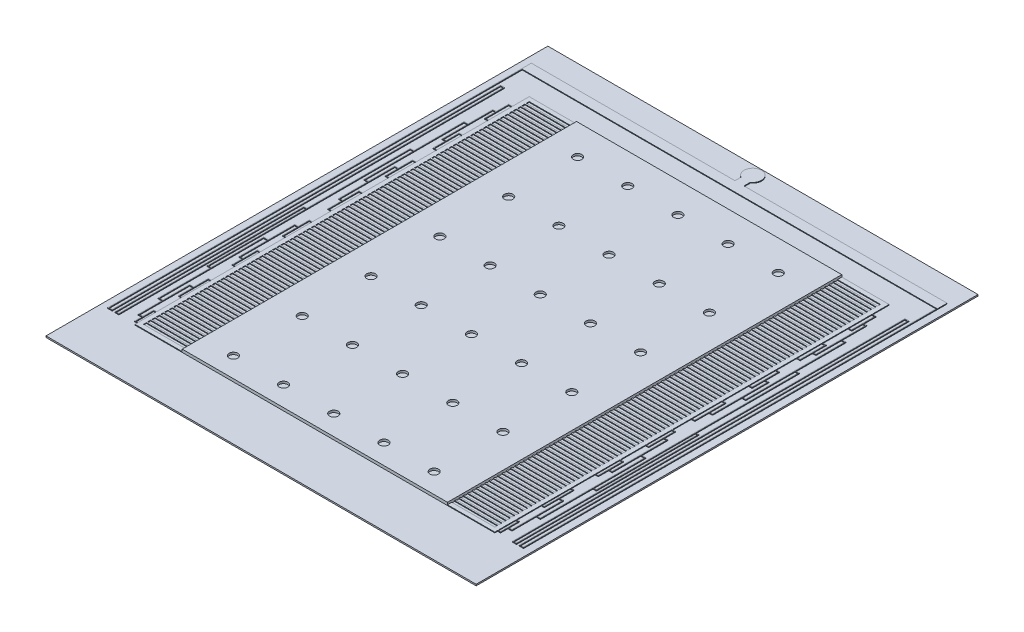
from build123d import *

# Parameters (mm, degrees)
SKETCH3_W            = 30
SKETCH3_H            = 35
BOSS_EXTRUDE2_DEPTH  = 0.1
SKETCH4_W            = 18.5
SKETCH4_H            = 27.5
BOSS_EXTRUDE5_DEPTH  = 0.2
SKETCH6_W            = 0.211382016
SKETCH6_H            = 1.603769596
SKETCH6_W_2          = 0.205195515
SKETCH6_H_2          = 1.721308545
SKETCH6_W_3          = 0.197922695
SKETCH6_H_3          = 1.817675336
SKETCH6_W_4          = 0.201706459
SKETCH6_H_4          = 2.081358624
SKETCH6_W_5          = 0.1704568
SKETCH6_H_5          = 1.774483983
SKETCH6_H_6          = 1.660070327
SKETCH6_W_6          = 0.157207296
SKETCH6_H_7          = 1.980065268
SKETCH6_H_8          = 1.224341961
BOSS_EXTRUDE10_DEPTH = 0.05
SKETCH7_W            = 3
SKETCH7_H            = 0.2
CUT_EXTRUDE2_DEPTH   = 0.1
SKETCH8_R            = 0.3
CUT_EXTRUDE3_DEPTH   = 0.15


with BuildPart() as part:
    # Sketch3 → Boss-Extrude2 (new body)
    with BuildSketch(Plane(origin=(0, 0, 0), x_dir=(1, 0, 0), z_dir=(0, 1, 0))):
        Rectangle(SKETCH3_W, SKETCH3_H)
    extrude(amount=BOSS_EXTRUDE2_DEPTH)



with BuildPart() as body_2:
    # Sketch4 → Boss-Extrude5 (new body)
    with BuildSketch(Plane(origin=(0, 0.1, 0), x_dir=(1, 0, 0), z_dir=(0, 1, 0))):
        Rectangle(SKETCH4_W, SKETCH4_H)
    extrude(amount=BOSS_EXTRUDE5_DEPTH)


with BuildPart() as part_1:
    add(part.part)

    add(body_2.part)  # Boss-Extrude10 merges body 2
    # Sketch6 → Boss-Extrude10 (add)
    with BuildSketch(Plane(origin=(0, 0.1, 0), x_dir=(1, 0, 0), z_dir=(0, 1, 0))):
        with BuildLine():
            Line((-0.296809866, 15.847390228), (-14.5, 15.847390228))
            Line((-14.5, 15.847390228), (-14.5, -13.694209009))
            Line((-14.5, -13.694209009), (-14.189003398, -13.694209009))
            Line((-14.189003398, -13.694209009), (-14.189003398, 13.393625624))
            Line((-14.189003398, 13.393625624), (-14.007853659, 13.393625624))
            Line((-14.007853659, 13.393625624), (-14.007853659, -13.695971627))
            Line((-14.007853659, -13.695971627), (-13.724275414, -13.695971627))
            Line((-13.724275414, -13.695971627), (-13.724275414, -0.799347863))
            Line((-13.724275414, -0.799347863), (-13.56977005, -0.799347863))
            Line((-13.56977005, -0.799347863), (-13.56977005, -7.686248839))
            Line((-13.56977005, -7.686248839), (-13.33084503, -7.686248839))
            Line((-13.33084503, -7.686248839), (-13.33084503, -11.352681055))
            Line((-13.33084503, -11.352681055), (-13.039851306, -11.352681055))
            Line((-13.039851306, -11.352681055), (-13.039851306, -13.03981721))
            Line((-13.039851306, -13.03981721), (-12.757207296, -13.03981721))
            Line((-12.757207296, -13.03981721), (-12.757207296, -13.557084166))
            Line((-12.757207296, -13.557084166), (-12.55, -13.557084166))
            Line((-12.55, -13.557084166), (-12.55, -13.75))
            Line((-12.55, -13.75), (-9.25, -13.75))
            Line((-9.25, -13.75), (-9.25, 13.75))
            Line((-9.25, 13.75), (-12.55, 13.75))
            Line((-12.55, 13.75), (-12.55, 12.581818208))
            Line((-12.55, 12.581818208), (-12.811382016, 12.581818208))
            Line((-12.811382016, 12.581818208), (-12.811382016, 11.702139278))
            Line((-12.811382016, 11.702139278), (-13.039543899, 11.702139278))
            Line((-13.039543899, 11.702139278), (-13.039543899, 9.973586997))
            Line((-13.039543899, 9.973586997), (-13.316086526, 9.973586997))
            Line((-13.316086526, 9.973586997), (-13.316086526, 6.471730618))
            Line((-13.316086526, 6.471730618), (-13.56977005, 6.471730618))
            Line((-13.56977005, 6.471730618), (-13.56977005, -0.749347863))
            Line((-13.56977005, -0.749347863), (-13.774275414, -0.749347863))
            Line((-13.774275414, -0.749347863), (-13.774275414, -13.645971627))
            Line((-13.774275414, -13.645971627), (-13.957853659, -13.645971627))
            Line((-13.957853659, -13.645971627), (-13.957853659, 13.443625624))
            Line((-13.957853659, 13.443625624), (-14.239003398, 13.443625624))
            Line((-14.239003398, 13.443625624), (-14.239003398, -13.644209009))
            Line((-14.239003398, -13.644209009), (-14.45, -13.644209009))
            Line((-14.45, -13.644209009), (-14.45, 15.162745559))
            Line((-14.45, 15.162745559), (14.45, 15.162745559))
            Line((14.45, 15.162745559), (14.45, -13.644209009))
            Line((14.45, -13.644209009), (14.239003398, -13.644209009))
            Line((14.239003398, -13.644209009), (14.239003398, 13.443625624))
            Line((14.239003398, 13.443625624), (13.957853659, 13.443625624))
            Line((13.957853659, 13.443625624), (13.957853659, -13.645971627))
            Line((13.957853659, -13.645971627), (13.774275414, -13.645971627))
            Line((13.774275414, -13.645971627), (13.774275414, -0.749347863))
            Line((13.774275414, -0.749347863), (13.56977005, -0.749347863))
            Line((13.56977005, -0.749347863), (13.56977005, 6.471730618))
            Line((13.56977005, 6.471730618), (13.316086526, 6.471730618))
            Line((13.316086526, 6.471730618), (13.316086526, 9.973586997))
            Line((13.316086526, 9.973586997), (13.039543899, 9.973586997))
            Line((13.039543899, 9.973586997), (13.039543899, 11.702139278))
            Line((13.039543899, 11.702139278), (12.811382016, 11.702139278))
            Line((12.811382016, 11.702139278), (12.811382016, 12.581818208))
            Line((12.811382016, 12.581818208), (12.55, 12.581818208))
            Line((12.55, 12.581818208), (12.55, 13.75))
            Line((12.55, 13.75), (9.25, 13.75))
            Line((9.25, 13.75), (9.25, -13.75))
            Line((9.25, -13.75), (12.55, -13.75))
            Line((12.55, -13.75), (12.55, -13.557084166))
            Line((12.55, -13.557084166), (12.757207296, -13.557084166))
            Line((12.757207296, -13.557084166), (12.757207296, -13.03981721))
            Line((12.757207296, -13.03981721), (13.039851306, -13.03981721))
            Line((13.039851306, -13.03981721), (13.039851306, -11.352681055))
            Line((13.039851306, -11.352681055), (13.33084503, -11.352681055))
            Line((13.33084503, -11.352681055), (13.33084503, -7.686248839))
            Line((13.33084503, -7.686248839), (13.56977005, -7.686248839))
            Line((13.56977005, -7.686248839), (13.56977005, -0.799347863))
            Line((13.56977005, -0.799347863), (13.724275414, -0.799347863))
            Line((13.724275414, -0.799347863), (13.724275414, -13.695971627))
            Line((13.724275414, -13.695971627), (14.007853659, -13.695971627))
            Line((14.007853659, -13.695971627), (14.007853659, 13.393625624))
            Line((14.007853659, 13.393625624), (14.189003398, 13.393625624))
            Line((14.189003398, 13.393625624), (14.189003398, -13.694209009))
            Line((14.189003398, -13.694209009), (14.5, -13.694209009))
            Line((14.5, -13.694209009), (14.5, 15.847390228))
            Line((14.5, 15.847390228), (0.33596793, 15.847390228))
            Line((0.33596793, 15.847390228), (0.33596793, 16.289908331))
            ThreePointArc((0.33596793, 16.289908331), (-0.022955128, 17.400932864), (-0.296809866, 16.265941738))
            Line((-0.296809866, 16.265941738), (-0.296809866, 15.847390228))
        make_face()
        with Locations((-12.655691008, 11.72993341)):
            Rectangle(SKETCH6_W, SKETCH6_H, mode=Mode.SUBTRACT)
        Polygon((-12.811382016, 10.878048612), (-12.55, 10.878048612), (-12.55, 9.112513729), (-12.805195515, 9.112513729), (-12.805195515, 8.207460352), (-12.989543899, 8.207460352), (-12.989543899, 11.652139278), (-12.811382016, 11.652139278), align=None, mode=Mode.SUBTRACT)
        with Locations((-12.652597758, 8.201859457)):
            Rectangle(SKETCH6_W_2, SKETCH6_H_2, mode=Mode.SUBTRACT)
        Polygon((-12.805195515, 7.291205184), (-12.55, 7.291205184), (-12.55, 5.863231856), (-12.797922695, 5.863231856), (-12.797922695, 4.872175714), (-13.044120695, 4.872175714), (-13.044120695, 3.034439681), (-13.266086526, 3.034439681), (-13.266086526, 9.923586997), (-13.039543899, 9.923586997), (-13.039543899, 8.157460352), (-12.805195515, 8.157460352), align=None, mode=Mode.SUBTRACT)
        with Locations((-12.648961348, 4.904394188)):
            Rectangle(SKETCH6_W_3, SKETCH6_H_3, mode=Mode.SUBTRACT)
        Polygon((-12.797922695, 3.94555652), (-12.55, 3.94555652), (-12.55, 2.131358624), (-12.801706459, 2.131358624), (-12.801706459, 0.989514943), (-12.994120695, 0.989514943), (-12.994120695, 4.822175714), (-12.797922695, 4.822175714), align=None, mode=Mode.SUBTRACT)
        with Locations((-12.65085323, 1.040679312)):
            Rectangle(SKETCH6_W_4, SKETCH6_H_4, mode=Mode.SUBTRACT)
        Polygon((-12.801706459, -0.05), (-12.55, -0.05), (-12.55, -1.362951225), (-12.7704568, -1.362951225), (-12.7704568, -2.137736179), (-13.014658955, -2.137736179), (-13.014658955, -3.988239391), (-13.33084503, -3.988239391), (-13.33084503, -7.636248839), (-13.51977005, -7.636248839), (-13.51977005, 6.421730618), (-13.316086526, 6.421730618), (-13.316086526, 2.984439681), (-13.044120695, 2.984439681), (-13.044120695, 0.939514943), (-12.801706459, 0.939514943), align=None, mode=Mode.SUBTRACT)
        with Locations((-12.6352284, -2.300193217)):
            Rectangle(SKETCH6_W_5, SKETCH6_H_5, mode=Mode.SUBTRACT)
        Polygon((-12.7704568, -3.237435208), (-12.55, -3.237435208), (-12.55, -4.988354149), (-12.7704568, -4.988354149), (-12.7704568, -5.98071835), (-12.964658955, -5.98071835), (-12.964658955, -2.187736179), (-12.7704568, -2.187736179), align=None, mode=Mode.SUBTRACT)
        with Locations((-12.6352284, -5.868389312)):
            Rectangle(SKETCH6_W_5, SKETCH6_H_6, mode=Mode.SUBTRACT)
        Polygon((-12.7704568, -6.748424476), (-12.55, -6.748424476), (-12.55, -8.421954299), (-12.757207296, -8.421954299), (-12.757207296, -9.437671871), (-13.039851306, -9.437671871), (-13.039851306, -11.302681055), (-13.28084503, -11.302681055), (-13.28084503, -4.038239391), (-13.014658955, -4.038239391), (-13.014658955, -6.03071835), (-12.7704568, -6.03071835), align=None, mode=Mode.SUBTRACT)
        with Locations((-12.628603648, -9.461986933)):
            Rectangle(SKETCH6_W_6, SKETCH6_H_7, mode=Mode.SUBTRACT)
        Polygon((-12.757207296, -10.502019567), (-12.55, -10.502019567), (-12.55, -12.232742205), (-12.757207296, -12.232742205), (-12.757207296, -12.98981721), (-12.989851306, -12.98981721), (-12.989851306, -9.487671871), (-12.757207296, -9.487671871), align=None, mode=Mode.SUBTRACT)
        with Locations((-12.628603648, -12.894913186)):
            Rectangle(SKETCH6_W_6, SKETCH6_H_8, mode=Mode.SUBTRACT)
        with Locations((12.628603648, -12.894913186)):
            Rectangle(SKETCH6_W_6, SKETCH6_H_8, mode=Mode.SUBTRACT)
        Polygon((12.757207296, -12.232742205), (12.55, -12.232742205), (12.55, -10.502019567), (12.757207296, -10.502019567), (12.757207296, -9.487671871), (12.989851306, -9.487671871), (12.989851306, -12.98981721), (12.757207296, -12.98981721), align=None, mode=Mode.SUBTRACT)
        with Locations((12.628603648, -9.461986933)):
            Rectangle(SKETCH6_W_6, SKETCH6_H_7, mode=Mode.SUBTRACT)
        Polygon((12.757207296, -8.421954299), (12.55, -8.421954299), (12.55, -6.748424476), (12.7704568, -6.748424476), (12.7704568, -6.03071835), (13.014658955, -6.03071835), (13.014658955, -4.038239391), (13.28084503, -4.038239391), (13.28084503, -11.302681055), (13.039851306, -11.302681055), (13.039851306, -9.437671871), (12.757207296, -9.437671871), align=None, mode=Mode.SUBTRACT)
        with Locations((12.6352284, -5.868389312)):
            Rectangle(SKETCH6_W_5, SKETCH6_H_6, mode=Mode.SUBTRACT)
        Polygon((12.7704568, -4.988354149), (12.55, -4.988354149), (12.55, -3.237435208), (12.7704568, -3.237435208), (12.7704568, -2.187736179), (12.964658955, -2.187736179), (12.964658955, -5.98071835), (12.7704568, -5.98071835), align=None, mode=Mode.SUBTRACT)
        with Locations((12.6352284, -2.300193217)):
            Rectangle(SKETCH6_W_5, SKETCH6_H_5, mode=Mode.SUBTRACT)
        Polygon((12.7704568, -1.362951225), (12.55, -1.362951225), (12.55, -0.05), (12.801706459, -0.05), (12.801706459, 0.939514943), (13.044120695, 0.939514943), (13.044120695, 2.984439681), (13.316086526, 2.984439681), (13.316086526, 6.421730618), (13.51977005, 6.421730618), (13.51977005, -7.636248839), (13.33084503, -7.636248839), (13.33084503, -3.988239391), (13.014658955, -3.988239391), (13.014658955, -2.137736179), (12.7704568, -2.137736179), align=None, mode=Mode.SUBTRACT)
        with Locations((12.65085323, 1.040679312)):
            Rectangle(SKETCH6_W_4, SKETCH6_H_4, mode=Mode.SUBTRACT)
        Polygon((12.801706459, 2.131358624), (12.55, 2.131358624), (12.55, 3.94555652), (12.797922695, 3.94555652), (12.797922695, 4.822175714), (12.994120695, 4.822175714), (12.994120695, 0.989514943), (12.801706459, 0.989514943), align=None, mode=Mode.SUBTRACT)
        with Locations((12.648961348, 4.904394188)):
            Rectangle(SKETCH6_W_3, SKETCH6_H_3, mode=Mode.SUBTRACT)
        Polygon((12.797922695, 5.863231856), (12.55, 5.863231856), (12.55, 7.291205184), (12.805195515, 7.291205184), (12.805195515, 8.157460352), (13.039543899, 8.157460352), (13.039543899, 9.923586997), (13.266086526, 9.923586997), (13.266086526, 3.034439681), (13.044120695, 3.034439681), (13.044120695, 4.872175714), (12.797922695, 4.872175714), align=None, mode=Mode.SUBTRACT)
        with Locations((12.652597758, 8.201859457)):
            Rectangle(SKETCH6_W_2, SKETCH6_H_2, mode=Mode.SUBTRACT)
        Polygon((12.805195515, 9.112513729), (12.55, 9.112513729), (12.55, 10.878048612), (12.811382016, 10.878048612), (12.811382016, 11.652139278), (12.989543899, 11.652139278), (12.989543899, 8.207460352), (12.805195515, 8.207460352), align=None, mode=Mode.SUBTRACT)
        with Locations((12.655691008, 11.72993341)):
            Rectangle(SKETCH6_W, SKETCH6_H, mode=Mode.SUBTRACT)
    extrude(amount=BOSS_EXTRUDE10_DEPTH)

    # Sketch7 → Cut-Extrude2 (cut)
    with BuildSketch(Plane(origin=(0, 0.1, 0), x_dir=(1, 0, 0), z_dir=(0, 1, 0))):
        with Locations((10.75, 13.35)):
            Rectangle(SKETCH7_W, SKETCH7_H)
        with Locations((10.75, 13.05)):
            Rectangle(SKETCH7_W, SKETCH7_H)
        with Locations((10.75, 12.75)):
            Rectangle(SKETCH7_W, SKETCH7_H)
        with Locations((10.75, 12.45)):
            Rectangle(SKETCH7_W, SKETCH7_H)
        with Locations((10.75, 12.15)):
            Rectangle(SKETCH7_W, SKETCH7_H)
        with Locations((10.75, 11.85)):
            Rectangle(SKETCH7_W, SKETCH7_H)
        with Locations((10.75, 11.55)):
            Rectangle(SKETCH7_W, SKETCH7_H)
        with Locations((10.75, 11.25)):
            Rectangle(SKETCH7_W, SKETCH7_H)
        with Locations((10.75, 10.95)):
            Rectangle(SKETCH7_W, SKETCH7_H)
        with Locations((10.75, 10.65)):
            Rectangle(SKETCH7_W, SKETCH7_H)
        with Locations((10.75, 10.35)):
            Rectangle(SKETCH7_W, SKETCH7_H)
        with Locations((10.75, 10.05)):
            Rectangle(SKETCH7_W, SKETCH7_H)
        with Locations((10.75, 9.75)):
            Rectangle(SKETCH7_W, SKETCH7_H)
        with Locations((10.75, 9.45)):
            Rectangle(SKETCH7_W, SKETCH7_H)
        with Locations((10.75, 9.15)):
            Rectangle(SKETCH7_W, SKETCH7_H)
        with Locations((10.75, 8.85)):
            Rectangle(SKETCH7_W, SKETCH7_H)
        with Locations((10.75, 8.55)):
            Rectangle(SKETCH7_W, SKETCH7_H)
        with Locations((10.75, 8.25)):
            Rectangle(SKETCH7_W, SKETCH7_H)
        with Locations((10.75, 7.95)):
            Rectangle(SKETCH7_W, SKETCH7_H)
        with Locations((10.75, 7.65)):
            Rectangle(SKETCH7_W, SKETCH7_H)
        with Locations((10.75, 7.35)):
            Rectangle(SKETCH7_W, SKETCH7_H)
        with Locations((10.75, 7.05)):
            Rectangle(SKETCH7_W, SKETCH7_H)
        with Locations((10.75, 6.75)):
            Rectangle(SKETCH7_W, SKETCH7_H)
        with Locations((10.75, 6.45)):
            Rectangle(SKETCH7_W, SKETCH7_H)
        with Locations((10.75, 6.15)):
            Rectangle(SKETCH7_W, SKETCH7_H)
        with Locations((10.75, 5.85)):
            Rectangle(SKETCH7_W, SKETCH7_H)
        with Locations((10.75, 5.55)):
            Rectangle(SKETCH7_W, SKETCH7_H)
        with Locations((10.75, 5.25)):
            Rectangle(SKETCH7_W, SKETCH7_H)
        with Locations((10.75, 4.95)):
            Rectangle(SKETCH7_W, SKETCH7_H)
        with Locations((10.75, 4.65)):
            Rectangle(SKETCH7_W, SKETCH7_H)
        with Locations((10.75, 4.35)):
            Rectangle(SKETCH7_W, SKETCH7_H)
        with Locations((10.75, 4.05)):
            Rectangle(SKETCH7_W, SKETCH7_H)
        with Locations((10.75, 3.75)):
            Rectangle(SKETCH7_W, SKETCH7_H)
        with Locations((10.75, 3.45)):
            Rectangle(SKETCH7_W, SKETCH7_H)
        with Locations((10.75, 3.15)):
            Rectangle(SKETCH7_W, SKETCH7_H)
        with Locations((10.75, 2.85)):
            Rectangle(SKETCH7_W, SKETCH7_H)
        with Locations((10.75, 2.55)):
            Rectangle(SKETCH7_W, SKETCH7_H)
        with Locations((10.75, 2.25)):
            Rectangle(SKETCH7_W, SKETCH7_H)
        with Locations((10.75, 1.95)):
            Rectangle(SKETCH7_W, SKETCH7_H)
        with Locations((10.75, 1.65)):
            Rectangle(SKETCH7_W, SKETCH7_H)
        with Locations((10.75, 1.35)):
            Rectangle(SKETCH7_W, SKETCH7_H)
        with Locations((10.75, 1.05)):
            Rectangle(SKETCH7_W, SKETCH7_H)
        with Locations((10.75, 0.75)):
            Rectangle(SKETCH7_W, SKETCH7_H)
        with Locations((10.75, 0.45)):
            Rectangle(SKETCH7_W, SKETCH7_H)
        with Locations((10.75, 0.15)):
            Rectangle(SKETCH7_W, SKETCH7_H)
        with Locations((10.75, -0.15)):
            Rectangle(SKETCH7_W, SKETCH7_H)
        with Locations((10.75, -0.45)):
            Rectangle(SKETCH7_W, SKETCH7_H)
        with Locations((10.75, -0.75)):
            Rectangle(SKETCH7_W, SKETCH7_H)
        with Locations((10.75, -1.05)):
            Rectangle(SKETCH7_W, SKETCH7_H)
        with Locations((10.75, -1.35)):
            Rectangle(SKETCH7_W, SKETCH7_H)
        with Locations((10.75, -1.65)):
            Rectangle(SKETCH7_W, SKETCH7_H)
        with Locations((10.75, -1.95)):
            Rectangle(SKETCH7_W, SKETCH7_H)
        with Locations((10.75, -2.25)):
            Rectangle(SKETCH7_W, SKETCH7_H)
        with Locations((10.75, -2.55)):
            Rectangle(SKETCH7_W, SKETCH7_H)
        with Locations((10.75, -2.85)):
            Rectangle(SKETCH7_W, SKETCH7_H)
        with Locations((10.75, -3.15)):
            Rectangle(SKETCH7_W, SKETCH7_H)
        with Locations((10.75, -3.45)):
            Rectangle(SKETCH7_W, SKETCH7_H)
        with Locations((10.75, -3.75)):
            Rectangle(SKETCH7_W, SKETCH7_H)
        with Locations((10.75, -4.05)):
            Rectangle(SKETCH7_W, SKETCH7_H)
        with Locations((10.75, -4.35)):
            Rectangle(SKETCH7_W, SKETCH7_H)
        with Locations((10.75, -4.65)):
            Rectangle(SKETCH7_W, SKETCH7_H)
        with Locations((10.75, -4.95)):
            Rectangle(SKETCH7_W, SKETCH7_H)
        with Locations((10.75, -5.25)):
            Rectangle(SKETCH7_W, SKETCH7_H)
        with Locations((10.75, -5.55)):
            Rectangle(SKETCH7_W, SKETCH7_H)
        with Locations((10.75, -5.85)):
            Rectangle(SKETCH7_W, SKETCH7_H)
        with Locations((10.75, -6.15)):
            Rectangle(SKETCH7_W, SKETCH7_H)
        with Locations((10.75, -6.45)):
            Rectangle(SKETCH7_W, SKETCH7_H)
        with Locations((10.75, -6.75)):
            Rectangle(SKETCH7_W, SKETCH7_H)
        with Locations((10.75, -7.05)):
            Rectangle(SKETCH7_W, SKETCH7_H)
        with Locations((10.75, -7.35)):
            Rectangle(SKETCH7_W, SKETCH7_H)
        with Locations((10.75, -7.65)):
            Rectangle(SKETCH7_W, SKETCH7_H)
        with Locations((10.75, -7.95)):
            Rectangle(SKETCH7_W, SKETCH7_H)
        with Locations((10.75, -8.25)):
            Rectangle(SKETCH7_W, SKETCH7_H)
        with Locations((10.75, -8.55)):
            Rectangle(SKETCH7_W, SKETCH7_H)
        with Locations((10.75, -8.85)):
            Rectangle(SKETCH7_W, SKETCH7_H)
        with Locations((10.75, -9.15)):
            Rectangle(SKETCH7_W, SKETCH7_H)
        with Locations((10.75, -9.45)):
            Rectangle(SKETCH7_W, SKETCH7_H)
        with Locations((10.75, -9.75)):
            Rectangle(SKETCH7_W, SKETCH7_H)
        with Locations((10.75, -10.05)):
            Rectangle(SKETCH7_W, SKETCH7_H)
        with Locations((10.75, -10.35)):
            Rectangle(SKETCH7_W, SKETCH7_H)
        with Locations((10.75, -10.65)):
            Rectangle(SKETCH7_W, SKETCH7_H)
        with Locations((10.75, -10.95)):
            Rectangle(SKETCH7_W, SKETCH7_H)
        with Locations((10.75, -11.25)):
            Rectangle(SKETCH7_W, SKETCH7_H)
        with Locations((10.75, -11.55)):
            Rectangle(SKETCH7_W, SKETCH7_H)
        with Locations((10.75, -11.85)):
            Rectangle(SKETCH7_W, SKETCH7_H)
        with Locations((10.75, -12.15)):
            Rectangle(SKETCH7_W, SKETCH7_H)
        with Locations((10.75, -12.45)):
            Rectangle(SKETCH7_W, SKETCH7_H)
        with Locations((10.75, -12.75)):
            Rectangle(SKETCH7_W, SKETCH7_H)
        with Locations((10.75, -13.05)):
            Rectangle(SKETCH7_W, SKETCH7_H)
        with Locations((10.75, -13.35)):
            Rectangle(SKETCH7_W, SKETCH7_H)
        with Locations((-10.75, 13.35)):
            Rectangle(SKETCH7_W, SKETCH7_H)
        with Locations((-10.75, 13.05)):
            Rectangle(SKETCH7_W, SKETCH7_H)
        with Locations((-10.75, 12.75)):
            Rectangle(SKETCH7_W, SKETCH7_H)
        with Locations((-10.75, 12.45)):
            Rectangle(SKETCH7_W, SKETCH7_H)
        with Locations((-10.75, 12.15)):
            Rectangle(SKETCH7_W, SKETCH7_H)
        with Locations((-10.75, 11.85)):
            Rectangle(SKETCH7_W, SKETCH7_H)
        with Locations((-10.75, 11.55)):
            Rectangle(SKETCH7_W, SKETCH7_H)
        with Locations((-10.75, 11.25)):
            Rectangle(SKETCH7_W, SKETCH7_H)
        with Locations((-10.75, 10.95)):
            Rectangle(SKETCH7_W, SKETCH7_H)
        with Locations((-10.75, 10.65)):
            Rectangle(SKETCH7_W, SKETCH7_H)
        with Locations((-10.75, 10.35)):
            Rectangle(SKETCH7_W, SKETCH7_H)
        with Locations((-10.75, 10.05)):
            Rectangle(SKETCH7_W, SKETCH7_H)
        with Locations((-10.75, 9.75)):
            Rectangle(SKETCH7_W, SKETCH7_H)
        with Locations((-10.75, 9.45)):
            Rectangle(SKETCH7_W, SKETCH7_H)
        with Locations((-10.75, 9.15)):
            Rectangle(SKETCH7_W, SKETCH7_H)
        with Locations((-10.75, 8.85)):
            Rectangle(SKETCH7_W, SKETCH7_H)
        with Locations((-10.75, 8.55)):
            Rectangle(SKETCH7_W, SKETCH7_H)
        with Locations((-10.75, 8.25)):
            Rectangle(SKETCH7_W, SKETCH7_H)
        with Locations((-10.75, 7.95)):
            Rectangle(SKETCH7_W, SKETCH7_H)
        with Locations((-10.75, 7.65)):
            Rectangle(SKETCH7_W, SKETCH7_H)
        with Locations((-10.75, 7.35)):
            Rectangle(SKETCH7_W, SKETCH7_H)
        with Locations((-10.75, 7.05)):
            Rectangle(SKETCH7_W, SKETCH7_H)
        with Locations((-10.75, 6.75)):
            Rectangle(SKETCH7_W, SKETCH7_H)
        with Locations((-10.75, 6.45)):
            Rectangle(SKETCH7_W, SKETCH7_H)
        with Locations((-10.75, 6.15)):
            Rectangle(SKETCH7_W, SKETCH7_H)
        with Locations((-10.75, 5.85)):
            Rectangle(SKETCH7_W, SKETCH7_H)
        with Locations((-10.75, 5.55)):
            Rectangle(SKETCH7_W, SKETCH7_H)
        with Locations((-10.75, 5.25)):
            Rectangle(SKETCH7_W, SKETCH7_H)
        with Locations((-10.75, 4.95)):
            Rectangle(SKETCH7_W, SKETCH7_H)
        with Locations((-10.75, 4.65)):
            Rectangle(SKETCH7_W, SKETCH7_H)
        with Locations((-10.75, 4.35)):
            Rectangle(SKETCH7_W, SKETCH7_H)
        with Locations((-10.75, 4.05)):
            Rectangle(SKETCH7_W, SKETCH7_H)
        with Locations((-10.75, 3.75)):
            Rectangle(SKETCH7_W, SKETCH7_H)
        with Locations((-10.75, 3.45)):
            Rectangle(SKETCH7_W, SKETCH7_H)
        with Locations((-10.75, 3.15)):
            Rectangle(SKETCH7_W, SKETCH7_H)
        with Locations((-10.75, 2.85)):
            Rectangle(SKETCH7_W, SKETCH7_H)
        with Locations((-10.75, 2.55)):
            Rectangle(SKETCH7_W, SKETCH7_H)
        with Locations((-10.75, 2.25)):
            Rectangle(SKETCH7_W, SKETCH7_H)
        with Locations((-10.75, 1.95)):
            Rectangle(SKETCH7_W, SKETCH7_H)
        with Locations((-10.75, 1.65)):
            Rectangle(SKETCH7_W, SKETCH7_H)
        with Locations((-10.75, 1.35)):
            Rectangle(SKETCH7_W, SKETCH7_H)
        with Locations((-10.75, 1.05)):
            Rectangle(SKETCH7_W, SKETCH7_H)
        with Locations((-10.75, 0.75)):
            Rectangle(SKETCH7_W, SKETCH7_H)
        with Locations((-10.75, 0.45)):
            Rectangle(SKETCH7_W, SKETCH7_H)
        with Locations((-10.75, 0.15)):
            Rectangle(SKETCH7_W, SKETCH7_H)
        with Locations((-10.75, -0.15)):
            Rectangle(SKETCH7_W, SKETCH7_H)
        with Locations((-10.75, -0.45)):
            Rectangle(SKETCH7_W, SKETCH7_H)
        with Locations((-10.75, -0.75)):
            Rectangle(SKETCH7_W, SKETCH7_H)
        with Locations((-10.75, -1.05)):
            Rectangle(SKETCH7_W, SKETCH7_H)
        with Locations((-10.75, -1.35)):
            Rectangle(SKETCH7_W, SKETCH7_H)
        with Locations((-10.75, -1.65)):
            Rectangle(SKETCH7_W, SKETCH7_H)
        with Locations((-10.75, -1.95)):
            Rectangle(SKETCH7_W, SKETCH7_H)
        with Locations((-10.75, -2.25)):
            Rectangle(SKETCH7_W, SKETCH7_H)
        with Locations((-10.75, -2.55)):
            Rectangle(SKETCH7_W, SKETCH7_H)
        with Locations((-10.75, -2.85)):
            Rectangle(SKETCH7_W, SKETCH7_H)
        with Locations((-10.75, -3.15)):
            Rectangle(SKETCH7_W, SKETCH7_H)
        with Locations((-10.75, -3.45)):
            Rectangle(SKETCH7_W, SKETCH7_H)
        with Locations((-10.75, -3.75)):
            Rectangle(SKETCH7_W, SKETCH7_H)
        with Locations((-10.75, -4.05)):
            Rectangle(SKETCH7_W, SKETCH7_H)
        with Locations((-10.75, -4.35)):
            Rectangle(SKETCH7_W, SKETCH7_H)
        with Locations((-10.75, -4.65)):
            Rectangle(SKETCH7_W, SKETCH7_H)
        with Locations((-10.75, -4.95)):
            Rectangle(SKETCH7_W, SKETCH7_H)
        with Locations((-10.75, -5.25)):
            Rectangle(SKETCH7_W, SKETCH7_H)
        with Locations((-10.75, -5.55)):
            Rectangle(SKETCH7_W, SKETCH7_H)
        with Locations((-10.75, -5.85)):
            Rectangle(SKETCH7_W, SKETCH7_H)
        with Locations((-10.75, -6.15)):
            Rectangle(SKETCH7_W, SKETCH7_H)
        with Locations((-10.75, -6.45)):
            Rectangle(SKETCH7_W, SKETCH7_H)
        with Locations((-10.75, -6.75)):
            Rectangle(SKETCH7_W, SKETCH7_H)
        with Locations((-10.75, -7.05)):
            Rectangle(SKETCH7_W, SKETCH7_H)
        with Locations((-10.75, -7.35)):
            Rectangle(SKETCH7_W, SKETCH7_H)
        with Locations((-10.75, -7.65)):
            Rectangle(SKETCH7_W, SKETCH7_H)
        with Locations((-10.75, -7.95)):
            Rectangle(SKETCH7_W, SKETCH7_H)
        with Locations((-10.75, -8.25)):
            Rectangle(SKETCH7_W, SKETCH7_H)
        with Locations((-10.75, -8.55)):
            Rectangle(SKETCH7_W, SKETCH7_H)
        with Locations((-10.75, -8.85)):
            Rectangle(SKETCH7_W, SKETCH7_H)
        with Locations((-10.75, -9.15)):
            Rectangle(SKETCH7_W, SKETCH7_H)
        with Locations((-10.75, -9.45)):
            Rectangle(SKETCH7_W, SKETCH7_H)
        with Locations((-10.75, -9.75)):
            Rectangle(SKETCH7_W, SKETCH7_H)
        with Locations((-10.75, -10.05)):
            Rectangle(SKETCH7_W, SKETCH7_H)
        with Locations((-10.75, -10.35)):
            Rectangle(SKETCH7_W, SKETCH7_H)
        with Locations((-10.75, -10.65)):
            Rectangle(SKETCH7_W, SKETCH7_H)
        with Locations((-10.75, -10.95)):
            Rectangle(SKETCH7_W, SKETCH7_H)
        with Locations((-10.75, -11.25)):
            Rectangle(SKETCH7_W, SKETCH7_H)
        with Locations((-10.75, -11.55)):
            Rectangle(SKETCH7_W, SKETCH7_H)
        with Locations((-10.75, -11.85)):
            Rectangle(SKETCH7_W, SKETCH7_H)
        with Locations((-10.75, -12.15)):
            Rectangle(SKETCH7_W, SKETCH7_H)
        with Locations((-10.75, -12.45)):
            Rectangle(SKETCH7_W, SKETCH7_H)
        with Locations((-10.75, -12.75)):
            Rectangle(SKETCH7_W, SKETCH7_H)
        with Locations((-10.75, -13.05)):
            Rectangle(SKETCH7_W, SKETCH7_H)
        with Locations((-10.75, -13.35)):
            Rectangle(SKETCH7_W, SKETCH7_H)
    extrude(amount=CUT_EXTRUDE2_DEPTH, mode=Mode.SUBTRACT)

    # Sketch8 → Cut-Extrude3 (cut)
    with BuildSketch(Plane(origin=(0, 0.3, 0), x_dir=(1, 0, 0), z_dir=(0, 1, 0))):
        with Locations((-0.068028452, 11.638869797)):
            Circle(SKETCH8_R)
        with Locations((-0.068028452, 2.038869797)):
            Circle(SKETCH8_R)
        with Locations((-0.068028452, 6.838869797)):
            Circle(SKETCH8_R)
        with Locations((-7.068028452, 11.638869797)):
            Circle(SKETCH8_R)
        with Locations((-3.568028452, 11.638869797)):
            Circle(SKETCH8_R)
        with Locations((3.431971548, 11.638869797)):
            Circle(SKETCH8_R)
        with Locations((6.931971548, 11.638869797)):
            Circle(SKETCH8_R)
        with Locations((-3.568028452, 6.838869797)):
            Circle(SKETCH8_R)
        with Locations((3.431971548, 6.838869797)):
            Circle(SKETCH8_R)
        with Locations((6.931971548, 6.838869797)):
            Circle(SKETCH8_R)
        with Locations((-3.568028452, 2.038869797)):
            Circle(SKETCH8_R)
        with Locations((3.431971548, 2.038869797)):
            Circle(SKETCH8_R)
        with Locations((6.931971548, 2.038869797)):
            Circle(SKETCH8_R)
        with Locations((-3.568028452, -2.761130203)):
            Circle(SKETCH8_R)
        with Locations((-0.068028452, -2.761130203)):
            Circle(SKETCH8_R)
        with Locations((3.431971548, -2.761130203)):
            Circle(SKETCH8_R)
        with Locations((6.931971548, -2.761130203)):
            Circle(SKETCH8_R)
        with Locations((-3.568028452, -7.561130203)):
            Circle(SKETCH8_R)
        with Locations((-0.068028452, -7.561130203)):
            Circle(SKETCH8_R)
        with Locations((3.431971548, -7.561130203)):
            Circle(SKETCH8_R)
        with Locations((6.931971548, -7.561130203)):
            Circle(SKETCH8_R)
        with Locations((-3.568028452, -12.361130203)):
            Circle(SKETCH8_R)
        with Locations((-0.068028452, -12.361130203)):
            Circle(SKETCH8_R)
        with Locations((3.431971548, -12.361130203)):
            Circle(SKETCH8_R)
        with Locations((6.931971548, -12.361130203)):
            Circle(SKETCH8_R)
        with Locations((-7.068028452, 6.838869797)):
            Circle(SKETCH8_R)
        with Locations((-7.068028452, 2.038869797)):
            Circle(SKETCH8_R)
        with Locations((-7.068028452, -2.761130203)):
            Circle(SKETCH8_R)
        with Locations((-7.068028452, -7.561130203)):
            Circle(SKETCH8_R)
        with Locations((-7.068028452, -12.361130203)):
            Circle(SKETCH8_R)
    extrude(amount=-CUT_EXTRUDE3_DEPTH, mode=Mode.SUBTRACT)


solid = part_1.part
